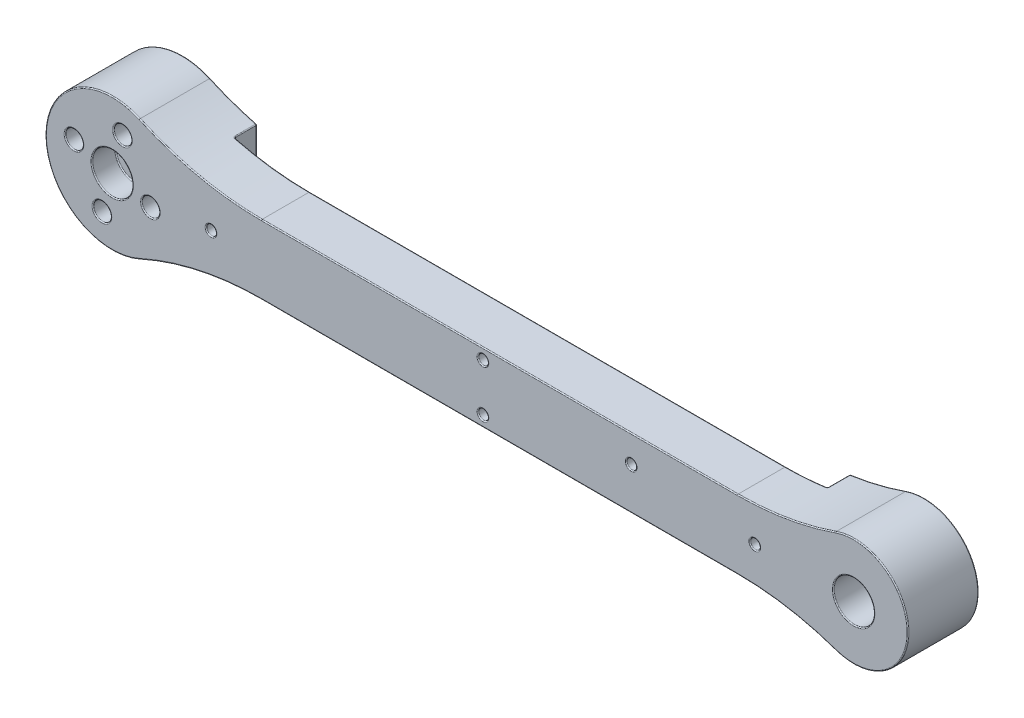
from build123d import *

# Parameters (mm, degrees)
SKETCH_1_R           = 1.8
SKETCH_1_R_2         = 1.7999999999999998
SKETCH_1_R_3         = 1.8000000000000007
SKETCH_1_R_4         = 4.1
EXTRUDE_1_DEPTH      = 14.3
SKETCH_3_R           = 4.1
SKETCH_3_R_2         = 2.45
EXTRUDE_2_DEPTH      = 9.5
SKETCH_5_R           = 11.000000000000007
SKETCH_5_R_2         = 4.800000000000002
SKETCH_5_R_3         = 4.099999999999986
EXTRUDE_3_DEPTH      = 14.3
SKETCH_5_3_R         = 4.800000000000002
SKETCH_5_3_R_2       = 4.099999999999986
CUT_EXTRUDE_6_DEPTH  = 1.8
SKETCH_6_W           = 120
SKETCH_6_H           = 14.000000000000002
SKETCH_6_R           = 0.9999999999999981
SKETCH_6_W_2         = 100.2
SKETCH_6_H_2         = 5.199999999999999
SKETCH_6_R_2         = 0.9999999999999983
SKETCH_6_R_3         = 1.0000000000000016
CUT_EXTRUDE_7_DEPTH  = 4.55
CUT_EXTRUDE_START    = -4.55
SKETCH_6_3_W         = 100.2
SKETCH_6_3_H         = 5.199999999999999
CUT_EXTRUDE_8_DEPTH  = 5.2
SKETCH_6_4_R         = 0.9999999999999983
SKETCH_6_4_R_2       = 0.9999999999999981
SKETCH_6_4_R_3       = 1.0000000000000016
CUT_EXTRUDE_9_DEPTH  = 163.0076850029035
SKETCH_9_R           = 0.9999999999999983
CUT_EXTRUDE_10_DEPTH = 163.0076850029035
SKETCH_10_R          = 13.5
SKETCH_10_R_2        = 11.000000000000002
EXTRUDE_4_DEPTH      = 14.3
SKETCH_4_R           = 1.8
SKETCH_4_R_2         = 1.8000000000000005
SKETCH_4_R_3         = 3
CUT_EXTRUDE_11_DEPTH = 5
FILLET_1_R           = 60
FILLET_2_R           = 0.2


with BuildPart() as part:
    # 스케치1 → 보스-돌출1 (new body)
    # profile 1 of 2: a face of its own
    with BuildSketch(Plane.XY):
        with BuildLine():
            ThreePointArc((8.48528137423857, 7.000000000000001), (4.69041575982343, 9.9498743710662), (6.7e-16, 11))
            ThreePointArc((0, 11), (-11, 3.12e-15), (-6.23e-15, -11))
            ThreePointArc((-2.02e-15, -11), (4.6904157598234315, -9.949874371066198), (8.485281374238568, -7.000000000000003))
            ThreePointArc((8.485281374238568, -7.000000000000003), (10.352248430090544, -3.718998849379743), (11, -2.69e-15))
            ThreePointArc((11, 0), (10.352248430090544, 3.7189988493797452), (8.48528137423857, 7.000000000000001))
        make_face()
        with Locations((-2.0705523608201424, -7.727406610312554)):
            Circle(SKETCH_1_R, mode=Mode.SUBTRACT)
        with Locations((7.727406610312554, -2.070552360820141)):
            Circle(SKETCH_1_R_2, mode=Mode.SUBTRACT)
        with Locations((-7.727406610312554, 2.0705523608201424)):
            Circle(SKETCH_1_R_3, mode=Mode.SUBTRACT)
        Circle(SKETCH_1_R_4, mode=Mode.SUBTRACT)
        with Locations((2.070552360820142, 7.727406610312554)):
            Circle(SKETCH_1_R_2, mode=Mode.SUBTRACT)
    # profile 2 of 2: a face of its own
    with BuildSketch(Plane.XY):
        with BuildLine():
            Line((50, 7), (8.485281374238568, 7))
            ThreePointArc((8.48528137423857, 7.000000000000001), (10.352248430090544, 3.7189988493797452), (11, 0))
            ThreePointArc((11, -2.69e-15), (10.352248430090544, -3.718998849379743), (8.485281374238568, -7.000000000000003))
            Line((8.485281374238568, -7), (50, -7))
            Line((50, -7), (50, 7))
        make_face()
    extrude(amount=EXTRUDE_1_DEPTH)

    # 스케치3 → 보스-돌출2 (add)
    with BuildSketch(Plane(origin=(0, 0, 0), x_dir=(-1, 0, 0), z_dir=(0, 0, -1))):
        Circle(SKETCH_3_R)
        Circle(SKETCH_3_R_2, mode=Mode.SUBTRACT)
    extrude(amount=-EXTRUDE_2_DEPTH)

    # 스케치5 → 보스-돌출3 (add)
    # profile 1 of 3: a face of its own
    with BuildSketch(Plane(origin=(0, 0, 0), x_dir=(-1, 0, 0), z_dir=(0, 0, -1))):
        with BuildLine():
            Line((-50, -7), (-50, 7))
            Line((-50, 7), (-141.51471862576142, 7))
            ThreePointArc((-141.51471862576142, 6.999999999999998), (-139.64775156990945, 3.718998849379743), (-139, 0))
            ThreePointArc((-139, -2.69e-15), (-139.64775156990945, -3.7189988493797452), (-141.51471862576142, -6.999999999999999))
            Line((-141.51471862576142, -7), (-50, -7))
        make_face()
    # profile 2 of 3: a face of its own
    with BuildSketch(Plane(origin=(0, 0, 0), x_dir=(-1, 0, 0), z_dir=(0, 0, -1))):
        with Locations((-150, 0)):
            Circle(SKETCH_5_R)
        with Locations((-150, 0)):
            Circle(SKETCH_5_R_2, mode=Mode.SUBTRACT)
    # profile 3 of 3: a face of its own
    with BuildSketch(Plane(origin=(0, 0, 0), x_dir=(-1, 0, 0), z_dir=(0, 0, -1))):
        with Locations((-150, 0)):
            Circle(SKETCH_5_R_2)
        with Locations((-150, 0)):
            Circle(SKETCH_5_R_3, mode=Mode.SUBTRACT)
    extrude(amount=-EXTRUDE_3_DEPTH)

    # 스케치5<3> → 컷-돌출6 (cut)
    with BuildSketch(Plane(origin=(0, 0, 0), x_dir=(-1, 0, 0), z_dir=(0, 0, -1))):
        with Locations((-150, 0)):
            Circle(SKETCH_5_3_R)
        with Locations((-150, 0)):
            Circle(SKETCH_5_3_R_2, mode=Mode.SUBTRACT)
    extrude(amount=-CUT_EXTRUDE_6_DEPTH, mode=Mode.SUBTRACT)

    # 스케치6 → 컷-돌출7 (cut)
    # profile 1 of 6: a face of its own
    with BuildSketch(Plane(origin=(0, 0, 0), x_dir=(-1, 0, 0), z_dir=(0, 0, -1))):
        with Locations((-75, 0)):
            Rectangle(SKETCH_6_W, SKETCH_6_H)
        with Locations((-74.99999999999999, -4.800000000000001)):
            Circle(SKETCH_6_R, mode=Mode.SUBTRACT)
        with Locations((-75, -4.88e-15)):
            Rectangle(SKETCH_6_W_2, SKETCH_6_H_2, mode=Mode.SUBTRACT)
        with Locations((-130, 0)):
            Circle(SKETCH_6_R_2, mode=Mode.SUBTRACT)
        with Locations((-20, 0)):
            Circle(SKETCH_6_R_3, mode=Mode.SUBTRACT)
        with Locations((-74.99999999999999, 4.800000000000001)):
            Circle(SKETCH_6_R, mode=Mode.SUBTRACT)
    # profile 2 of 6: a face of its own
    with BuildSketch(Plane(origin=(0, 0, 0), x_dir=(-1, 0, 0), z_dir=(0, 0, -1))):
        with Locations((-75, -5.11e-15)):
            Rectangle(SKETCH_6_W_2, SKETCH_6_H_2)
    # profile 3 of 6: a face of its own
    with BuildSketch(Plane(origin=(0, 0, 0), x_dir=(-1, 0, 0), z_dir=(0, 0, -1))):
        with Locations((-130, 0)):
            Circle(SKETCH_6_R_2)
    # profile 4 of 6: a face of its own
    with BuildSketch(Plane(origin=(0, 0, 0), x_dir=(-1, 0, 0), z_dir=(0, 0, -1))):
        with Locations((-74.99999999999999, 4.800000000000001)):
            Circle(SKETCH_6_R)
    # profile 5 of 6: a face of its own
    with BuildSketch(Plane(origin=(0, 0, 0), x_dir=(-1, 0, 0), z_dir=(0, 0, -1))):
        with Locations((-74.99999999999999, -4.800000000000001)):
            Circle(SKETCH_6_R)
    # profile 6 of 6: a face of its own
    with BuildSketch(Plane(origin=(0, 0, 0), x_dir=(-1, 0, 0), z_dir=(0, 0, -1))):
        with Locations((-20, 0)):
            Circle(SKETCH_6_R_3)
    extrude(amount=-CUT_EXTRUDE_7_DEPTH, mode=Mode.SUBTRACT)

    # 스케치6<3> → 컷-돌출8 (cut)
    with BuildSketch(Plane(origin=(0, 0, 0), x_dir=(-1, 0, 0), z_dir=(0, 0, -1)).offset(CUT_EXTRUDE_START)):
        with Locations((-75, -5.11e-15)):
            Rectangle(SKETCH_6_3_W, SKETCH_6_3_H)
    extrude(amount=-CUT_EXTRUDE_8_DEPTH, mode=Mode.SUBTRACT)

    # 스케치6<4> → 컷-돌출9 (cut, through all)
    with BuildSketch(Plane(origin=(0, 0, 0), x_dir=(-1, 0, 0), z_dir=(0, 0, -1))):
        with Locations((-130, 0)):
            Circle(SKETCH_6_4_R)
        with Locations((-74.99999999999999, 4.800000000000001)):
            Circle(SKETCH_6_4_R_2)
        with Locations((-74.99999999999999, -4.800000000000001)):
            Circle(SKETCH_6_4_R_2)
        with Locations((-20, 0)):
            Circle(SKETCH_6_4_R_3)
    extrude(amount=-CUT_EXTRUDE_9_DEPTH, mode=Mode.SUBTRACT)

    # 스케치9 → 컷-돌출10 (cut, through all)
    with BuildSketch(Plane(origin=(0, 0, 0), x_dir=(-1, 0, 0), z_dir=(0, 0, -1))):
        with Locations((-104.99999999999999, 1.5000000000000004)):
            Circle(SKETCH_9_R)
    extrude(amount=-CUT_EXTRUDE_10_DEPTH, mode=Mode.SUBTRACT)

    # 스케치10 → 보스-돌출4 (add)
    with BuildSketch(Plane(origin=(0, 0, 0), x_dir=(-1, 0, 0), z_dir=(0, 0, -1))):
        Circle(SKETCH_10_R)
        Circle(SKETCH_10_R_2, mode=Mode.SUBTRACT)
    extrude(amount=-EXTRUDE_4_DEPTH)

    # 스케치4 → 컷-돌출11 (cut)
    # profile 1 of 5: a face of its own
    with BuildSketch(Plane(origin=(0, 0, 0), x_dir=(-1, 0, 0), z_dir=(0, 0, -1))):
        with BuildLine():
            ThreePointArc((0.9294476391798581, 7.727406610312554), (-0.24426811634977996, 10.107466663840473), (-2.8470095997530214, 10.625184061413435))
            ThreePointArc((-2.8470095997530214, 10.625184061413435), (-4.45061241434806, 9.553690854782916), (-5.070552360820142, 7.727406610312554))
            ThreePointArc((-5.070552360820142, 7.727406610312554), (-2.0705523608201415, 4.7274066103125545), (0.929447639179859, 7.727406610312554))
        make_face()
        with Locations(Location((-2.070552360820142, 7.727406610312554, 0), (0, 0, 180))):
            Circle(SKETCH_4_R, mode=Mode.SUBTRACT)
    # profile 2 of 5: a face of its own
    with BuildSketch(Plane(origin=(0, 0, 0), x_dir=(-1, 0, 0), z_dir=(0, 0, -1))):
        with BuildLine():
            ThreePointArc((10.727406610312553, 2.0705523608201424), (10.701741186048663, 2.4621310011731348), (10.625184055925422, 2.847009620234569))
            ThreePointArc((10.625184055925422, 2.847009620234569), (9.55369084637176, 4.450612420802168), (7.727406610312554, 5.070552360820143))
            ThreePointArc((7.727406610312554, 5.070552360820142), (4.727406610312553, 2.0705523608201424), (7.727406610312553, -0.9294476391798581))
            ThreePointArc((7.727406610312553, -0.9294476391798576), (9.848726953872195, -0.05076798273950045), (10.727406610312553, 2.0705523608201415))
        make_face()
        with Locations(Location((7.727406610312554, 2.0705523608201424, 0), (0, 0, 180))):
            Circle(SKETCH_4_R_2, mode=Mode.SUBTRACT)
    # profile 3 of 5: a face of its own
    with BuildSketch(Plane(origin=(0, 0, 0), x_dir=(-1, 0, 0), z_dir=(0, 0, -1))):
        with Locations(Location((-7.727406610312554, -2.070552360820141, 0), (0, 0, 180))):
            Circle(SKETCH_4_R_3)
        with Locations(Location((-7.727406610312554, -2.070552360820141, 0), (0, 0, 180))):
            Circle(SKETCH_4_R, mode=Mode.SUBTRACT)
    # profile 4 of 5: a face of its own
    with BuildSketch(Plane(origin=(0, 0, 0), x_dir=(-1, 0, 0), z_dir=(0, 0, -1))):
        with BuildLine():
            ThreePointArc((-0.9294476391798572, -7.727406610312554), (0.24426813837070926, -10.107466680737724), (2.8470096533749882, -10.62518404704547))
            ThreePointArc((2.8470096533749882, -10.62518404704547), (4.450612431245313, -9.553690832761987), (5.070552360820142, -7.7274066103125545))
            ThreePointArc((5.070552360820143, -7.727406610312554), (2.0705523608201424, -4.7274066103125545), (-0.9294476391798576, -7.727406610312554))
        make_face()
        with Locations(Location((2.0705523608201424, -7.727406610312554, 0), (0, 0, 180))):
            Circle(SKETCH_4_R, mode=Mode.SUBTRACT)
    # profile 5 of 5: a face of its own
    with BuildSketch(Plane(origin=(0, 0, 0), x_dir=(-1, 0, 0), z_dir=(0, 0, -1))):
        with Locations(Location((-2.070552360820142, 7.727406610312554, 0), (0, 0, 180))):
            Circle(SKETCH_4_R)
    extrude(amount=-CUT_EXTRUDE_11_DEPTH, mode=Mode.SUBTRACT)

    # 필렛1
    # the kernel refuses this fillet: 60 mm, written as the material it adds along each edge
    with BuildSketch(Plane(origin=(11.543396380615196, 7, 14.3), x_dir=(1, -3.8e-16, 0), z_dir=(0, 0, -1))) as fillet_1_piece_1_section:
        with BuildLine():
            CenterArc((18.676630091910013, -60.00000000000001), FILLET_1_R, 89.99999999999999, 24.277525336655657)
            ThreePointArc((-5.992779273416405, -5.306122448980223), (-2.594091483514093, -3.107420138626977), (0, 0))
            Line((0, 0), (18.676630091910035, 0))
        make_face()
    fillet_1_piece_1 = extrude(amount=14.3, mode=Mode.PRIVATE)
    fillet_1_piece_1 = split(fillet_1_piece_1, bisect_by=Plane(origin=(21.26893727442578, 6.817004800843989, 4.55), z_dir=(0, 0, 1)), keep=Keep.TOP, mode=Mode.PRIVATE)
    fillet_1_piece_1 = split(fillet_1_piece_1, bisect_by=Plane(origin=(15, 6.817004800843989, 9.424999999999965), z_dir=(1, 0, 0)), keep=Keep.TOP, mode=Mode.PRIVATE)
    add(fillet_1_piece_1)
    with BuildSketch(Plane(origin=(11.543396380615196, 7, 14.3), x_dir=(1, -3.8e-16, 0), z_dir=(0, 0, -1))) as fillet_1_piece_2_section:
        with BuildLine():
            CenterArc((18.676630091910013, -60.00000000000001), FILLET_1_R, 89.99999999999999, 24.277525336655657)
            ThreePointArc((-5.992779273416405, -5.306122448980223), (-2.594091483514093, -3.107420138626977), (0, 0))
            Line((0, 0), (18.676630091910035, 0))
        make_face()
    fillet_1_piece_2 = extrude(amount=14.3, mode=Mode.PRIVATE)
    fillet_1_piece_2 = split(fillet_1_piece_2, bisect_by=Plane(origin=(10.971826600975703, 8.618147747196936, 4.55), z_dir=(0, 0, 1)), keep=Keep.TOP, mode=Mode.PRIVATE)
    fillet_1_piece_2 = split(fillet_1_piece_2, bisect_by=Plane(origin=(15, 8.618147747196936, 9.425000000000024), z_dir=(-1, 0, 0)), keep=Keep.TOP, mode=Mode.PRIVATE)
    add(fillet_1_piece_2)
    with BuildSketch(Plane(origin=(11.543396380615196, 7, 14.3), x_dir=(1, -3.8e-16, 0), z_dir=(0, 0, -1))) as fillet_1_piece_3_section:
        with BuildLine():
            CenterArc((18.676630091910013, -60.00000000000001), FILLET_1_R, 89.99999999999999, 24.277525336655657)
            ThreePointArc((-5.992779273416405, -5.306122448980223), (-2.594091483514093, -3.107420138626977), (0, 0))
            Line((0, 0), (18.676630091910035, 0))
        make_face()
    fillet_1_piece_3 = extrude(amount=14.3, mode=Mode.PRIVATE)
    fillet_1_piece_3 = split(fillet_1_piece_3, bisect_by=Plane(origin=(10.971826600975703, 8.618147747196936, 4.55), z_dir=(0, 0, -1)), keep=Keep.TOP, mode=Mode.PRIVATE)
    fillet_1_piece_3 = split(fillet_1_piece_3, bisect_by=Plane(origin=(15, 8.618147747196936, 2.274999999999989), z_dir=(-1, 0, 0)), keep=Keep.TOP, mode=Mode.PRIVATE)
    add(fillet_1_piece_3)
    with BuildSketch(Plane(origin=(11.543396380615196, -7, 14.3), x_dir=(1, 3.8e-16, 0), z_dir=(0, 0, -1))) as fillet_1_piece_4_section:
        with BuildLine():
            CenterArc((18.67663009191005, 60.00000000000001), FILLET_1_R, 245.72247466334431, 24.277525336655685)
            ThreePointArc((-5.9927792734163905, 5.306122448980237), (-2.594091483514091, 3.107420138626975), (0, 0))
            Line((0, 0), (18.67663009191007, 0))
        make_face()
    fillet_1_piece_4 = extrude(amount=14.3, mode=Mode.PRIVATE)
    fillet_1_piece_4 = split(fillet_1_piece_4, bisect_by=Plane(origin=(15, -6.817004800843995, 9.424999999999956), z_dir=(1, 0, 0)), keep=Keep.TOP, mode=Mode.PRIVATE)
    fillet_1_piece_4 = split(fillet_1_piece_4, bisect_by=Plane(origin=(21.268937274425795, -6.817004800843995, 4.55), z_dir=(0, 0, 1)), keep=Keep.TOP, mode=Mode.PRIVATE)
    add(fillet_1_piece_4)
    with BuildSketch(Plane(origin=(11.543396380615196, -7, 14.3), x_dir=(1, 3.8e-16, 0), z_dir=(0, 0, -1))) as fillet_1_piece_5_section:
        with BuildLine():
            CenterArc((18.67663009191005, 60.00000000000001), FILLET_1_R, 245.72247466334431, 24.277525336655685)
            ThreePointArc((-5.9927792734163905, 5.306122448980237), (-2.594091483514091, 3.107420138626975), (0, 0))
            Line((0, 0), (18.67663009191007, 0))
        make_face()
    fillet_1_piece_5 = extrude(amount=14.3, mode=Mode.PRIVATE)
    fillet_1_piece_5 = split(fillet_1_piece_5, bisect_by=Plane(origin=(15, -8.618147747196941, 9.425000000000024), z_dir=(-1, 0, 0)), keep=Keep.TOP, mode=Mode.PRIVATE)
    fillet_1_piece_5 = split(fillet_1_piece_5, bisect_by=Plane(origin=(10.971826600975717, -8.618147747196941, 4.55), z_dir=(0, 0, 1)), keep=Keep.TOP, mode=Mode.PRIVATE)
    add(fillet_1_piece_5)
    with BuildSketch(Plane(origin=(11.543396380615196, -7, 14.3), x_dir=(1, 3.8e-16, 0), z_dir=(0, 0, -1))) as fillet_1_piece_6_section:
        with BuildLine():
            CenterArc((18.67663009191005, 60.00000000000001), FILLET_1_R, 245.72247466334431, 24.277525336655685)
            ThreePointArc((-5.9927792734163905, 5.306122448980237), (-2.594091483514091, 3.107420138626975), (0, 0))
            Line((0, 0), (18.67663009191007, 0))
        make_face()
    fillet_1_piece_6 = extrude(amount=14.3, mode=Mode.PRIVATE)
    fillet_1_piece_6 = split(fillet_1_piece_6, bisect_by=Plane(origin=(15, -8.618147747196947, 2.274999999999987), z_dir=(-1, 0, 0)), keep=Keep.TOP, mode=Mode.PRIVATE)
    fillet_1_piece_6 = split(fillet_1_piece_6, bisect_by=Plane(origin=(10.971826600975717, -8.618147747196947, 4.55), z_dir=(0, 0, -1)), keep=Keep.TOP, mode=Mode.PRIVATE)
    add(fillet_1_piece_6)
    with BuildSketch(Plane(origin=(141.51471862576142, -7, 0), x_dir=(-1, 4.7e-16, 0), z_dir=(0, 0, 1))) as fillet_1_piece_7_section:
        with BuildLine():
            CenterArc((15.00939887470524, 60.00000000000001), FILLET_1_R, 250.67592183989365, 19.32407816010641)
            ThreePointArc((-4.845260490599175, 3.3802816901414636), (-2.191449887187333, 2.0215123572825844), (0, 0))
            Line((0, 0), (15.00939887470527, 0))
        make_face()
    fillet_1_piece_7 = extrude(amount=14.3, mode=Mode.PRIVATE)
    fillet_1_piece_7 = split(fillet_1_piece_7, bisect_by=Plane(origin=(140.5427086376834, -7.56409828132521, 4.55), z_dir=(0, 0, -1)), keep=Keep.TOP, mode=Mode.PRIVATE)
    fillet_1_piece_7 = split(fillet_1_piece_7, bisect_by=Plane(origin=(135, -7.56409828132521, 2.2750000000000115), z_dir=(1, 0, 0)), keep=Keep.TOP, mode=Mode.PRIVATE)
    add(fillet_1_piece_7)
    with BuildSketch(Plane(origin=(141.51471862576142, -7, 0), x_dir=(-1, 4.7e-16, 0), z_dir=(0, 0, 1))) as fillet_1_piece_8_section:
        with BuildLine():
            CenterArc((15.00939887470524, 60.00000000000001), FILLET_1_R, 250.67592183989365, 19.32407816010641)
            ThreePointArc((-4.845260490599175, 3.3802816901414636), (-2.191449887187333, 2.0215123572825844), (0, 0))
            Line((0, 0), (15.00939887470527, 0))
        make_face()
    fillet_1_piece_8 = extrude(amount=14.3, mode=Mode.PRIVATE)
    fillet_1_piece_8 = split(fillet_1_piece_8, bisect_by=Plane(origin=(131.05771374547365, -6.512095456716082, 4.55), z_dir=(0, 0, 1)), keep=Keep.TOP, mode=Mode.PRIVATE)
    fillet_1_piece_8 = split(fillet_1_piece_8, bisect_by=Plane(origin=(135, -6.512095456716082, 9.425000000000045), z_dir=(-1, 0, 0)), keep=Keep.TOP, mode=Mode.PRIVATE)
    add(fillet_1_piece_8)
    with BuildSketch(Plane(origin=(141.51471862576142, -7, 0), x_dir=(-1, 4.7e-16, 0), z_dir=(0, 0, 1))) as fillet_1_piece_9_section:
        with BuildLine():
            CenterArc((15.00939887470524, 60.00000000000001), FILLET_1_R, 250.67592183989365, 19.32407816010641)
            ThreePointArc((-4.845260490599175, 3.3802816901414636), (-2.191449887187333, 2.0215123572825844), (0, 0))
            Line((0, 0), (15.00939887470527, 0))
        make_face()
    fillet_1_piece_9 = extrude(amount=14.3, mode=Mode.PRIVATE)
    fillet_1_piece_9 = split(fillet_1_piece_9, bisect_by=Plane(origin=(140.5427086376834, -7.56409828132521, 4.55), z_dir=(0, 0, 1)), keep=Keep.TOP, mode=Mode.PRIVATE)
    fillet_1_piece_9 = split(fillet_1_piece_9, bisect_by=Plane(origin=(135, -7.56409828132521, 9.424999999999976), z_dir=(1, 0, 0)), keep=Keep.TOP, mode=Mode.PRIVATE)
    add(fillet_1_piece_9)
    with BuildSketch(Plane(origin=(141.51471862576142, 6.999999999999998, 0), x_dir=(0.8201374870256823, 0.5721664988228502, 0), z_dir=(0, 0, 1))) as fillet_1_piece_10_section:
        with BuildLine():
            CenterArc((22.02021925450391, 57.79612442511595), FILLET_1_R, 235.0985590992675, 19.324078160106637)
            Line((-12.309770674867325, 8.587875203575159), (0, 0))
            ThreePointArc((0, 0), (2.9539318512139374, 0.40404385539540366), (5.907863702427861, 1e-16))
        make_face()
    fillet_1_piece_10 = extrude(amount=14.3, mode=Mode.PRIVATE)
    fillet_1_piece_10 = split(fillet_1_piece_10, bisect_by=Plane(origin=(135, 7.564098281324759, 2.2750000000000132), z_dir=(1, 0, 0)), keep=Keep.TOP, mode=Mode.PRIVATE)
    fillet_1_piece_10 = split(fillet_1_piece_10, bisect_by=Plane(origin=(140.54270863768335, 7.564098281324759, 4.55), z_dir=(0, 0, -1)), keep=Keep.TOP, mode=Mode.PRIVATE)
    add(fillet_1_piece_10)
    with BuildSketch(Plane(origin=(141.51471862576142, 6.999999999999998, 0), x_dir=(0.8201374870256823, 0.5721664988228502, 0), z_dir=(0, 0, 1))) as fillet_1_piece_11_section:
        with BuildLine():
            CenterArc((22.02021925450391, 57.79612442511595), FILLET_1_R, 235.0985590992675, 19.324078160106637)
            Line((-12.309770674867325, 8.587875203575159), (0, 0))
            ThreePointArc((0, 0), (2.9539318512139374, 0.40404385539540366), (5.907863702427861, 1e-16))
        make_face()
    fillet_1_piece_11 = extrude(amount=14.3, mode=Mode.PRIVATE)
    fillet_1_piece_11 = split(fillet_1_piece_11, bisect_by=Plane(origin=(135, 7.564098281324759, 9.424999999999974), z_dir=(1, 0, 0)), keep=Keep.TOP, mode=Mode.PRIVATE)
    fillet_1_piece_11 = split(fillet_1_piece_11, bisect_by=Plane(origin=(140.54270863768335, 7.564098281324759, 4.55), z_dir=(0, 0, 1)), keep=Keep.TOP, mode=Mode.PRIVATE)
    add(fillet_1_piece_11)
    with BuildSketch(Plane(origin=(141.51471862576142, 6.999999999999998, 0), x_dir=(0.8201374870256823, 0.5721664988228502, 0), z_dir=(0, 0, 1))) as fillet_1_piece_12_section:
        with BuildLine():
            CenterArc((22.02021925450391, 57.79612442511595), FILLET_1_R, 235.0985590992675, 19.324078160106637)
            Line((-12.309770674867325, 8.587875203575159), (0, 0))
            ThreePointArc((0, 0), (2.9539318512139374, 0.40404385539540366), (5.907863702427861, 1e-16))
        make_face()
    fillet_1_piece_12 = extrude(amount=14.3, mode=Mode.PRIVATE)
    fillet_1_piece_12 = split(fillet_1_piece_12, bisect_by=Plane(origin=(135, 6.51209545671545, 9.425000000000043), z_dir=(-1, 0, 0)), keep=Keep.TOP, mode=Mode.PRIVATE)
    fillet_1_piece_12 = split(fillet_1_piece_12, bisect_by=Plane(origin=(131.0577137454735, 6.51209545671545, 4.55), z_dir=(0, 0, 1)), keep=Keep.TOP, mode=Mode.PRIVATE)
    add(fillet_1_piece_12)

    # 필렛2
    fillet_2_edges = [part.edges().sort_by_distance(p)[0] for p in [
        (5.927406610312554, -2.070552360820141, 14.3),
        (75.99999999999999, -4.800000000000001, 4.55),
        (75.99999999999999, -4.800000000000001, 14.3),
        (21, 1.2e-16, 4.55),
        (21, 1.2e-16, 14.3),
        (105.99999999999999, 1.5000000000000007, 14.3),
        (-7.727406610312549, 5.0705523608201455, 5),
        (-7.727406610312553, 5.070552360820142, 0),
        (-9.527406610312553, 2.070552360820142, 5),
        (4.727406610312554, -2.070552360820142, 5),
        (4.727406610312554, -2.070552360820142, 0),
        (5.927406610312554, -2.0705523608201415, 5),
        (0.2705523608201421, 7.727406610312554, 14.3),
        (0.9294476391798576, -7.727406610312557, 5),
        (0.9294476391798541, -7.727406610312556, 0),
        (-3.8705523608201426, -7.727406610312554, 5),
        (1.2940951218872718, 4.829629159211677, 5),
        (1.294095121887258, 4.829629159211677, 0),
        (0.2705523608201421, 7.727406610312554, 5),
        (78.36267311179057, 6.999999999999999, 14.3),
        (78.36267311179057, 7, 4.55),
        (-13.500000000000002, -1.155e-14, 0),
        (-13.5, -3.55e-15, 14.3),
        (78.36267311179049, -7, 4.55),
        (78.3626731117905, -7, 14.3),
        (161, -4.0899e-13, 14.3),
        (161, -4.0899e-13, 0),
        (17.60322523491306, 8.341528092434984, 14.3),
        (10.205363926775107, 10.436643635832958, 0),
        (15, 8.962505273094031, 2.2750000000000004),
        (22.547011537519268, 7.492648842288574, 4.550000000000001),
        (17.603225234913065, -8.341528092434984, 14.3),
        (22.547011537519275, -7.492648842288581, 4.550000000000001),
        (15, -8.962505273094031, 2.2750000000000004),
        (10.205363926775107, -10.436643635832958, 0),
        (140.74778022125923, -8.714904823319557, 0),
        (135, -7.604373835540713, 2.275),
        (130.76339620248586, -7.151284183085615, 4.55),
        (136.57549605061698, -7.851106947840854, 14.3),
        (130.76339620248598, 7.151284183085622, 4.55),
        (135.00000000000003, 7.604373835540471, 2.275),
        (140.74778022125994, 8.714904823319108, 0),
        (136.57549605061757, 7.851106947840606, 14.3),
        (-9.527406610312553, 2.070552360820142, 14.3),
        (-3.8705523608201426, -7.727406610312554, 14.3),
        (-4.1, 5e-16, 14.3),
        (2.45, 3e-16, 0),
        (2.45, 3e-16, 9.5),
        (-4.1, -1e-15, 9.5),
        (154.1, 5e-16, 14.3),
        (154.8, 5.9e-16, 1.8),
        (154.1, 5e-16, 1.8),
        (154.8, 5.9e-16, 0),
        (135, -1.2079e-13, 0),
        (14.999999999999995, 3.55e-15, 4.550000000000001),
        (135, -1.279e-13, 4.55),
        (14.999999999999998, -3.55e-15, 0),
        (24.89999999999999, -4.88e-15, 4.55),
        (75, 2.5999999999999948, 4.55),
        (125.1, -5.33e-15, 4.55),
        (75, -2.600000000000005, 4.55),
        (131, 1.2e-16, 4.55),
        (131, 1.2e-16, 14.3),
        (75.99999999999999, 4.800000000000001, 4.55),
        (75.99999999999999, 4.800000000000001, 14.3),
    ]]
    fillet(fillet_2_edges, radius=FILLET_2_R)


solid = part.part
